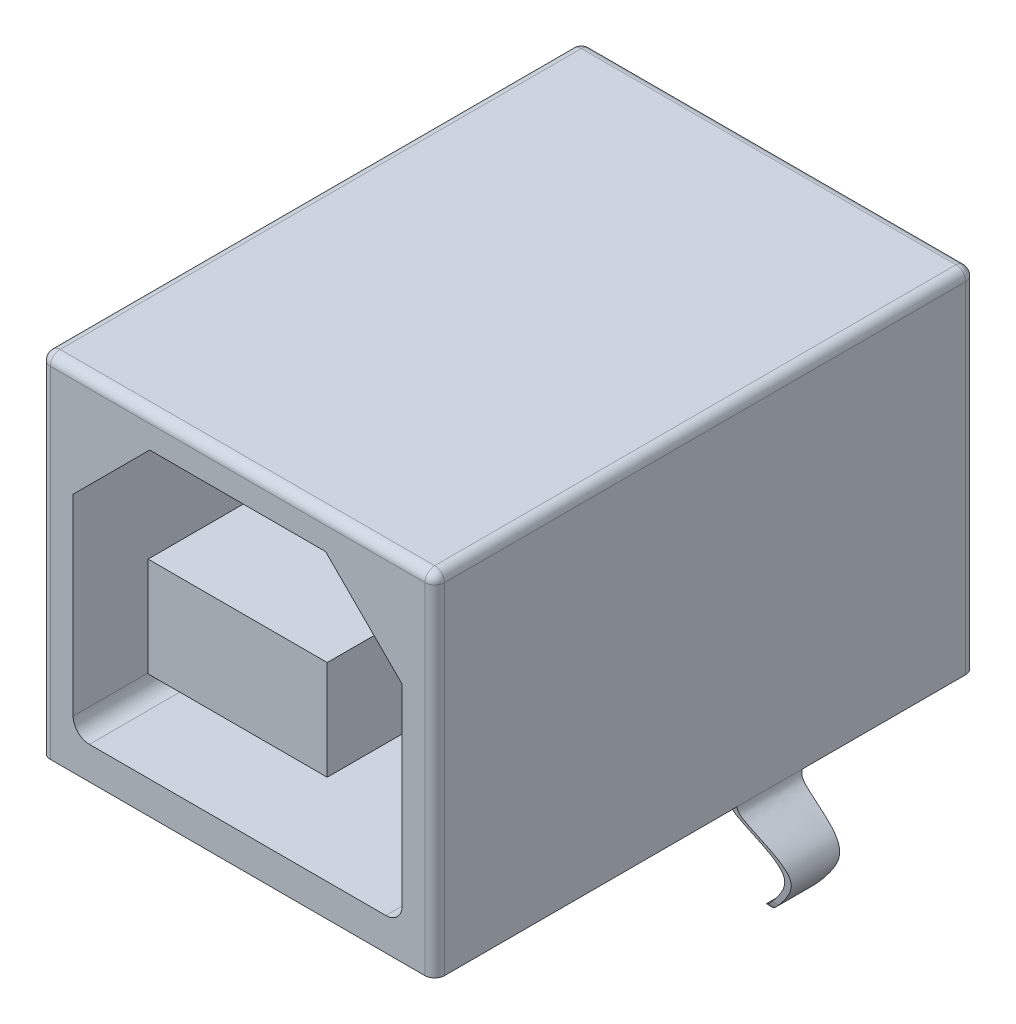
from build123d import *

# Parameters (mm, degrees)
SKETCH1_W           = 12.1
SKETCH1_H           = 10.75
BOSS_EXTRUDE1_DEPTH = 16.6
SKETCH2_W           = 5.5
SKETCH2_H           = 3.05
CUT_EXTRUDE1_DEPTH  = 14
SKETCH3_W           = 0.6
SKETCH3_H           = 0.1
BOSS_EXTRUDE2_DEPTH = 2.8
CHAMFER1_SIZE       = 0.2
BOSS_EXTRUDE3_DEPTH = 0.3
BOSS_EXTRUDE4_DEPTH = 1
BOSS_EXTRUDE5_START = -1
BOSS_EXTRUDE5_DEPTH = 3
FILLET2_R           = 0.3


# Read off the part's stored shape, not the designer's step: Boss-Extrude5
with BuildPart() as part:
    # Sketch1 → Boss-Extrude1 (new body)
    with BuildSketch(Plane.XY):
        with Locations((6.05, 5.375)):
            Rectangle(SKETCH1_W, SKETCH1_H)
    extrude(amount=BOSS_EXTRUDE1_DEPTH)

    # Sketch2 → Cut-Extrude1 (cut)
    with BuildSketch(Plane.XY.offset(16.6)):
        with BuildLine():
            Line((8.75, 9.75), (3.35, 9.75))
            Line((3.35, 9.75), (1, 7.4))
            Line((1, 7.4), (1, 1.5))
            ThreePointArc((1, 1.5), (1.146446609, 1.146446609), (1.5, 1))
            Line((1.5, 1), (10.6, 1))
            ThreePointArc((10.6, 1), (10.953553391, 1.146446609), (11.1, 1.5))
            Line((11.1, 1.5), (11.1, 7.4))
            Line((11.1, 7.4), (8.75, 9.75))
        make_face()
        with Locations((6.05, 5.3)):
            Rectangle(SKETCH2_W, SKETCH2_H, mode=Mode.SUBTRACT)
    extrude(amount=-CUT_EXTRUDE1_DEPTH, mode=Mode.SUBTRACT)

    # Sketch3 → Boss-Extrude2 (add)
    with BuildSketch(Plane.XZ):
        with Locations((4.8, 3.61)):
            Rectangle(SKETCH3_W, SKETCH3_H)
        with Locations((7.3, 1.61)):
            Rectangle(SKETCH3_W, SKETCH3_H)
        with Locations((7.3, 3.61)):
            Rectangle(SKETCH3_W, SKETCH3_H)
        with Locations((4.8, 1.61)):
            Rectangle(SKETCH3_W, SKETCH3_H)
    extrude(amount=BOSS_EXTRUDE2_DEPTH)

    # Chamfer1
    chamfer1_edges = [part.edges().sort_by_distance(p)[0] for p in [
        (4.5, -2.8, 3.61),
        (5.1, -2.8, 3.61),
        (7, -2.8, 1.61),
        (7.6, -2.8, 1.61),
        (4.5, -2.8, 1.61),
        (5.1, -2.8, 1.61),
        (7, -2.8, 3.61),
        (7.6, -2.8, 3.61),
    ]]
    chamfer(chamfer1_edges, length=CHAMFER1_SIZE)

    # Sketch4 → Boss-Extrude3 (add)
    with BuildSketch(Plane.XZ):
        with BuildLine():
            Line((9.25, 0), (9.25, 9.5))
            ThreePointArc((9.25, 9.5), (9.85, 10.1), (10.45, 9.5))
            Line((10.45, 9.5), (10.45, 0))
            Line((10.45, 0), (9.25, 0))
        make_face()
        with BuildLine():
            Line((5.45, 0), (6.65, 0))
            Line((6.65, 0), (6.65, 13.29))
            ThreePointArc((6.65, 13.29), (6.05, 13.89), (5.45, 13.29))
            Line((5.45, 13.29), (5.45, 0))
        make_face()
        with BuildLine():
            Line((1.65, 0), (2.85, 0))
            Line((2.85, 0), (2.85, 9.5))
            ThreePointArc((2.85, 9.5), (2.25, 10.1), (1.65, 9.5))
            Line((1.65, 9.5), (1.65, 0))
        make_face()
    extrude(amount=BOSS_EXTRUDE3_DEPTH)

    # Sketch5 → Boss-Extrude4 (add, symmetric)
    with BuildSketch(Plane.XY.offset(6.32)):
        with BuildLine():
            Line((11.9, 0), (12.1, 0))
            add(Edge.make_bspline(
                [(12.1, 0), (12.1, -0.024145003), (12.089879584, -0.182163302), (12.719459998, -0.652484582), (13.799601356, -1.166101624), (13.126986348, -2.265709602), (12.733513913, -2.642868504), (12.415284391, -2.884704656)],
                knots=[0, 0, 0, 0, 0.017031877, 0.127038198, 0.537057516, 0.700883083, 1, 1, 1, 1], degree=3))
            Line((12.415284391, -2.884704656), (12.337903204, -2.78878153))
            add(Edge.make_bspline(
                [(11.9, 0), (11.9, -0.024145003), (11.889879584, -0.182163302), (12.519459998, -0.652484582), (13.599601356, -1.166101624), (13.024215984, -2.106756141), (12.673426146, -2.503156788), (12.425560494, -2.718068393), (12.337903204, -2.78878153)],
                knots=[0, 0, 0, 0, 0.017031877, 0.127038198, 0.537057516, 0.700883083, 0.873809301, 0.960571543, 0.960571543, 0.960571543, 0.960571543], degree=3))
        make_face()
    boss_extrude4 = extrude(amount=BOSS_EXTRUDE4_DEPTH, both=True)

    # Mirror4: Boss-Extrude4 across plane
    add(boss_extrude4.mirror(Plane(origin=(6.05, 0, 0), x_dir=(0, 0, 1), z_dir=(1, 0, 0))))


with BuildPart() as body_2:
    # Boss-Extrude5 outline → Boss-Extrude5 (new body)
    with BuildSketch(Plane(origin=(12.1, 0, 0), x_dir=(0, 0, -1), z_dir=(1, 0, 0)).offset(BOSS_EXTRUDE5_START)):
        with BuildLine():
            Line((-4.417195228, 0), (-5.32, 0))
            Line((-5.32, 0), (-5.743329449, -2.40082061))
            ThreePointArc((-5.743329449, -2.40082061), (-6.32, -2.884704656), (-6.896670551, -2.40082061))
            Line((-6.896670551, -2.40082061), (-7.32, 0))
            Line((-7.32, 0), (-8.990049294, 0))
            Line((-8.990049294, 0), (-8.990049294, -4.045127485))
            Line((-8.990049294, -4.045127485), (-4.417195228, -4.045127485))
            Line((-4.417195228, -4.045127485), (-4.417195228, 0))
        make_face()
    extrude(amount=BOSS_EXTRUDE5_DEPTH)


with BuildPart() as body_3:
    # Body-Move/Copy1: copy of body 2
    add(body_2.part.moved(Location((-13, 0, 0))))


with BuildPart() as part_1:
    add(part.part)

    # Combine2: cut body 3, body 2
    add(body_3.part, mode=Mode.SUBTRACT)
    add(body_2.part, mode=Mode.SUBTRACT)

    # Fillet2
    fillet2_edges = [part_1.edges().sort_by_distance(p)[0] for p in [
        (12.1, 5.375, 16.6),
        (6.05, 10.75, 16.6),
        (0, 5.375, 16.6),
        (6.05, 10.75, 0),
        (12.1, 5.375, 0),
        (0, 5.375, 0),
        (0, 10.75, 8.3),
        (12.1, 10.75, 8.3),
    ]]
    fillet(fillet2_edges, radius=FILLET2_R)


solid = part_1.part
